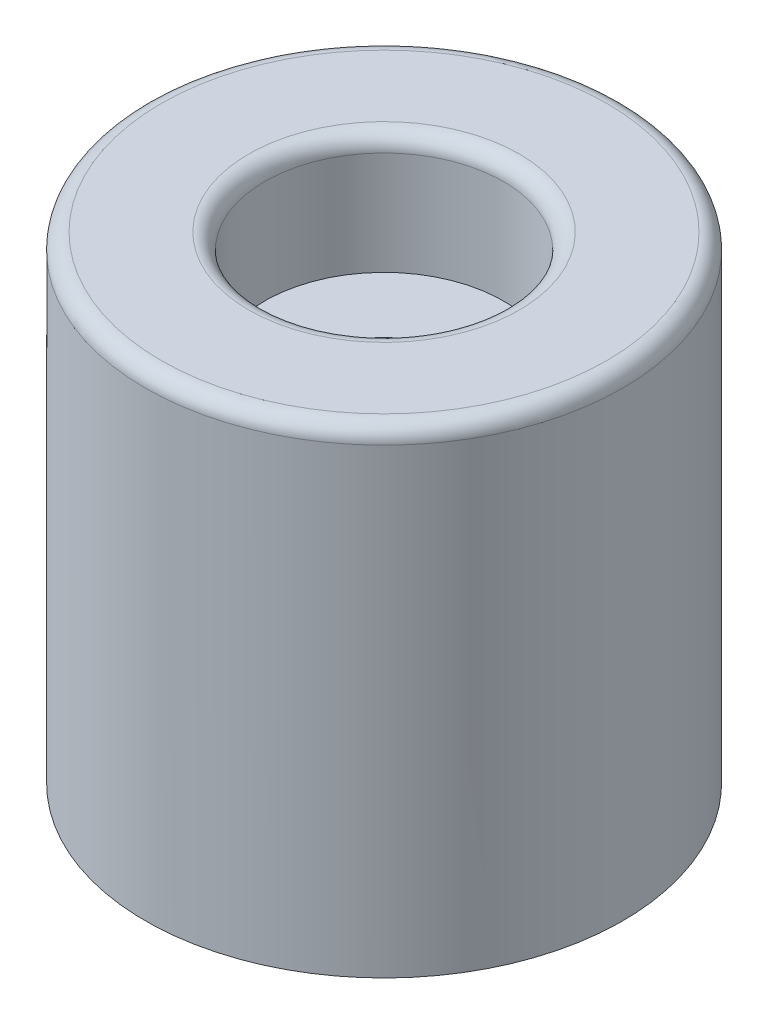
from build123d import *

# Parameters (mm, degrees)
SKETCH1_R           = 19.05
BOSS_EXTRUDE1_DEPTH = 38.1
SKETCH2_R           = 9.525
CUT_EXTRUDE1_DEPTH  = 9.525
SKETCH3_R           = 3.175
CUT_EXTRUDE2_DEPTH  = 40.272581084
FILLET1_R           = 1.27


with BuildPart() as part:
    # Sketch1 → Boss-Extrude1 (new body)
    with BuildSketch(Plane(origin=(0, 0, 0), x_dir=(1, 0, 0), z_dir=(0, 1, 0))):
        Circle(SKETCH1_R)
    extrude(amount=BOSS_EXTRUDE1_DEPTH)

    # Sketch2 → Cut-Extrude1 (cut)
    with BuildSketch(Plane(origin=(0, 38.1, 0), x_dir=(1, 0, 0), z_dir=(0, 1, 0))):
        Circle(SKETCH2_R)
    extrude(amount=-CUT_EXTRUDE1_DEPTH, mode=Mode.SUBTRACT)

    # Sketch3 → Cut-Extrude2 (cut, through all)
    with BuildSketch(Plane(origin=(0, 28.575, 0), x_dir=(1, 0, 0), z_dir=(0, 1, 0))):
        Circle(SKETCH3_R)
    extrude(amount=-CUT_EXTRUDE2_DEPTH, mode=Mode.SUBTRACT)

    # Fillet1
    fillet1_edges = [part.edges().sort_by_distance(p)[0] for p in [
        (-9.525, 38.1, 0),
        (-19.05, 38.1, 0),
    ]]
    fillet(fillet1_edges, radius=FILLET1_R)


solid = part.part
